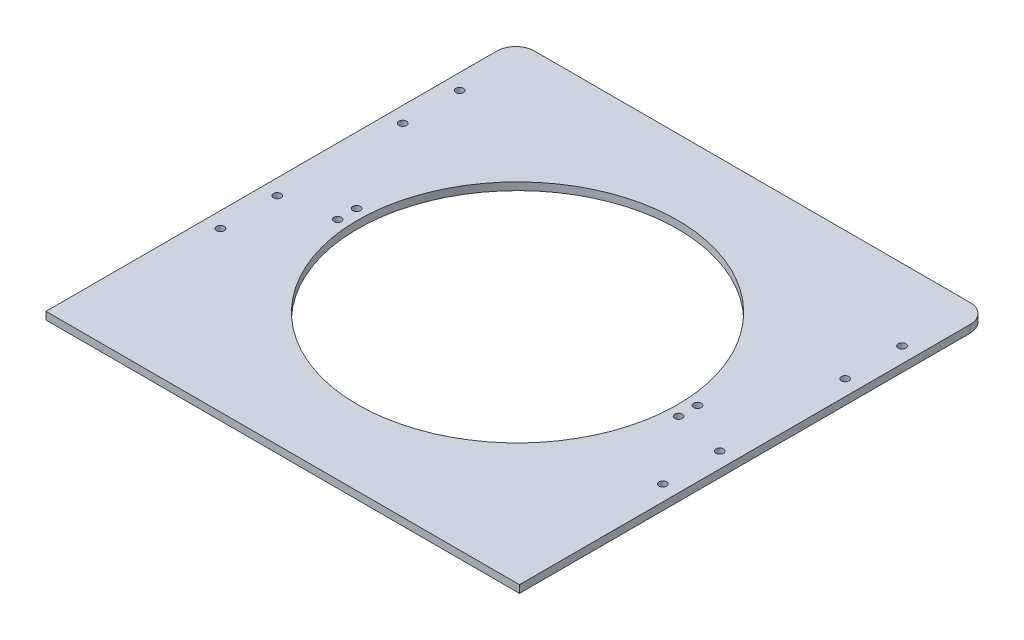
from build123d import *

# Parameters (mm, degrees)
SALIENTE_EXTRUIR1_DEPTH = 4
CROQUIS2_R              = 84.42
CROQUIS2_R_2            = 2
CORTAR_EXTRUIR1_DEPTH   = 4
CROQUIS3_R              = 2
CORTAR_EXTRUIR2_DEPTH   = 10


with BuildPart() as part:
    # Croquis1 → Saliente-Extruir1 (new body)
    with BuildSketch(Plane(origin=(0, 0, 0), x_dir=(1, 0, 0), z_dir=(0, 1, 0))):
        with BuildLine():
            Line((-125, -124), (125, -124))
            Line((125, -124), (125, 114))
            ThreePointArc((125, 114), (122.071067812, 121.071067812), (115, 124))
            Line((115, 124), (-115, 124))
            ThreePointArc((-115, 124), (-122.071067812, 121.071067812), (-125, 114))
            Line((-125, 114), (-125, -124))
        make_face()
    extrude(amount=SALIENTE_EXTRUIR1_DEPTH)

    # Croquis2 → Cortar-Extruir1 (cut)
    with BuildSketch(Plane(origin=(0, 4, 0), x_dir=(1, 0, 0), z_dir=(0, 1, 0))):
        Circle(CROQUIS2_R)
        with Locations((-90, 5)):
            Circle(CROQUIS2_R_2)
        with Locations((-90, -5)):
            Circle(CROQUIS2_R_2)
        with Locations((90, -5)):
            Circle(CROQUIS2_R_2)
        with Locations((90, 5)):
            Circle(CROQUIS2_R_2)
    extrude(amount=-CORTAR_EXTRUIR1_DEPTH, mode=Mode.SUBTRACT)

    # Croquis3 → Cortar-Extruir2 (cut)
    with BuildSketch(Plane(origin=(0, 4, 0), x_dir=(1, 0, 0), z_dir=(0, 1, 0))):
        with Locations((-116.8, 86.2)):
            Circle(CROQUIS3_R)
        with Locations((-116.8, 56.15)):
            Circle(CROQUIS3_R)
        with Locations((-116.8, -10.05)):
            Circle(CROQUIS3_R)
        with Locations((-116.8, -40.1)):
            Circle(CROQUIS3_R)
        with Locations((116.8, -40.1)):
            Circle(CROQUIS3_R)
        with Locations((116.8, -10.05)):
            Circle(CROQUIS3_R)
        with Locations((116.8, 56.15)):
            Circle(CROQUIS3_R)
        with Locations((116.8, 86.2)):
            Circle(CROQUIS3_R)
    extrude(amount=-CORTAR_EXTRUIR2_DEPTH, mode=Mode.SUBTRACT)


solid = part.part
